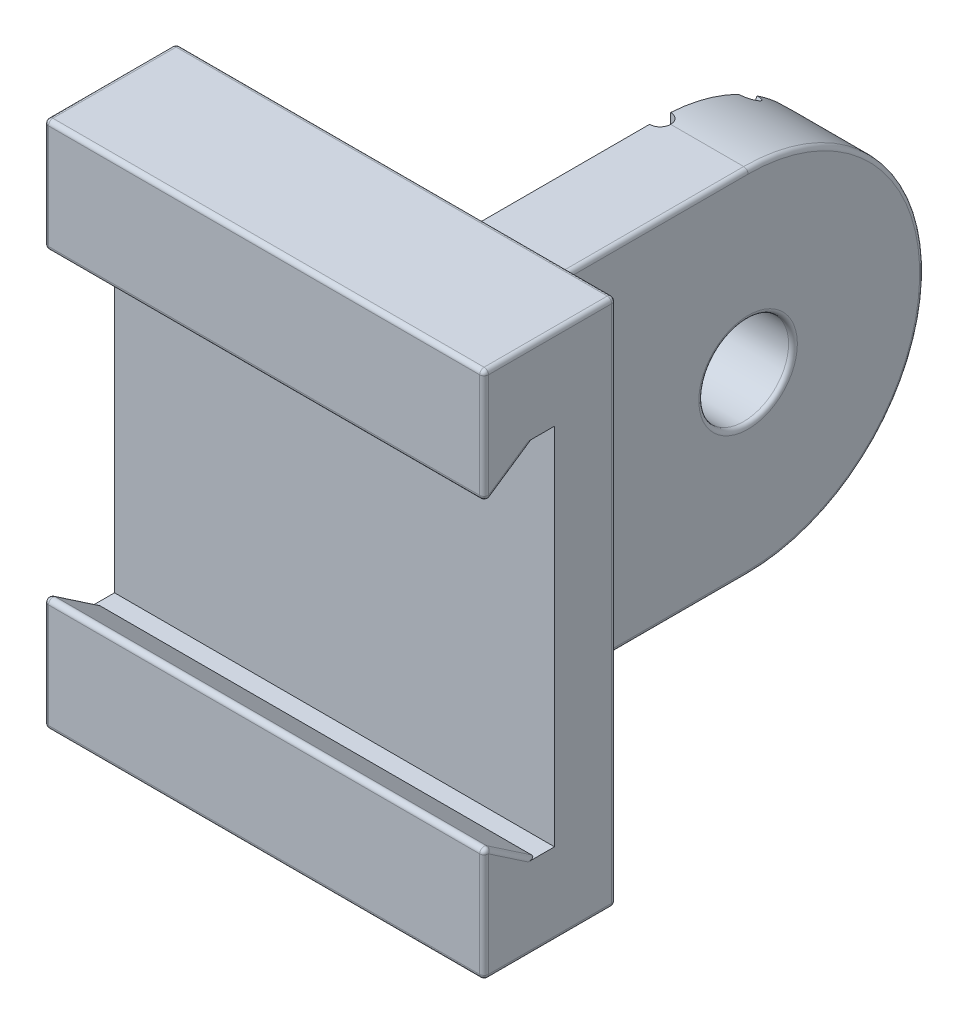
from build123d import *

# Parameters (mm, degrees)
BOSS_EXTRUDE1_DEPTH     = 10
CUT_REVOLVE_THIN2_START = -20
CUT_REVOLVE_THIN2_DEPTH = 40
SKETCH9_W               = 15
SKETCH9_H               = 60
BOSS_EXTRUDE2_DEPTH     = 25
SKETCH10_W              = 15
SKETCH10_H              = 60
BOSS_EXTRUDE3_DEPTH     = 25
CUT_EXTRUDE8_DEPTH      = 74.654599313
CUT_REVOLVE_THIN1_START = -20.0000001
CUT_REVOLVE_THIN1_DEPTH = 40.5000001
SKETCH20_R              = 5.1
CUT_EXTRUDE11_DEPTH     = 65.420493634
FILLET2_R               = 0.5
FILLET3_R               = 0.5
FILLET4_R               = 0.5
FILLET5_R               = 0.5
FILLET6_R               = 0.5
FILLET7_R               = 0.5
FILLET8_R               = 0.5
FILLET9_R               = 0.5
FILLET10_R              = 0.5
CUT_REVOLVE_THIN3_START = -20
CUT_REVOLVE_THIN3_DEPTH = 40.5
CUT_REVOLVE_THIN4_START = -20
CUT_REVOLVE_THIN4_DEPTH = 40.5
CUT_REVOLVE_THIN5_START = -20
CUT_REVOLVE_THIN5_DEPTH = 40.5
CUT_REVOLVE_THIN6_START = -20.5
CUT_REVOLVE_THIN6_DEPTH = 40.499999631
CUT_REVOLVE_THIN7_START = -20.5
CUT_REVOLVE_THIN7_DEPTH = 40.499999631
CUT_REVOLVE_THIN8_START = -20.5
CUT_REVOLVE_THIN8_DEPTH = 40.499999631
SKETCH27_R              = 9
CUT_EXTRUDE10_DEPTH     = 1.2
SKETCH7_R               = 5
CUT_EXTRUDE5_DEPTH      = 65.420493634


# Read off the part's stored shape, not the designer's step: Cut-Revolve-Thin2, Cut-Revolve-Thin1, Cut-Revolve-Thin3, Cut-Revolve-Thin4, Cut-Revolve-Thin5, Cut-Revolve-Thin6, Cut-Revolve-Thin7, Cut-Revolve-Thin8
with BuildPart() as part:
    # Sketch1 → Boss-Extrude1 (new body)
    with BuildSketch(Plane(origin=(0, 0, 0), x_dir=(0, 0, -1), z_dir=(1, 0, 0))):
        with BuildLine():
            Line((0, 20), (-30, 20))
            Line((-30, 20), (-30, -20))
            Line((-30, -20), (0, -20))
            ThreePointArc((0, -20), (20, 0), (0, 20))
        make_face()
    extrude(amount=BOSS_EXTRUDE1_DEPTH)

    # Cut-Revolve-Thin2 outline → Cut-Revolve-Thin2 (cut)
    with BuildSketch(Plane(origin=(0, 0, 0), x_dir=(1, 0, 0), z_dir=(0, 1, 0)).offset(CUT_REVOLVE_THIN2_START)):
        with BuildLine():
            Line((0, 1.2), (0, -1.2))
            ThreePointArc((0, -1.2), (1.2, 0), (0, 1.2))
        make_face()
    extrude(amount=CUT_REVOLVE_THIN2_DEPTH, mode=Mode.SUBTRACT)

    # Sketch9 → Boss-Extrude2 (add)
    with BuildSketch(Plane.ZY):
        with Locations((37.5, 0)):
            Rectangle(SKETCH9_W, SKETCH9_H)
    extrude(amount=-BOSS_EXTRUDE2_DEPTH)

    # Sketch10 → Boss-Extrude3 (add)
    with BuildSketch(Plane.ZY):
        with Locations((37.5, 0)):
            Rectangle(SKETCH10_W, SKETCH10_H)
    extrude(amount=BOSS_EXTRUDE3_DEPTH)

    # Sketch11 → Cut-Extrude8 (cut, through all)
    with BuildSketch(Plane.ZY.offset(25)):
        Polygon((39.1, 20.7), (37, 20.7), (37, -20.7), (39.1, -20.7), (45, -16.7), (45, 16.7), align=None)
    extrude(amount=-CUT_EXTRUDE8_DEPTH, mode=Mode.SUBTRACT)

    # Cut-Revolve-Thin1 outline → Cut-Revolve-Thin1 (cut)
    with BuildSketch(Plane.XY.offset(CUT_REVOLVE_THIN1_START)):
        with BuildLine():
            ThreePointArc((0, -1.2), (1.2, 0), (0, 1.2))
            Line((0, 1.2), (0, -1.2))
        make_face()
    extrude(amount=CUT_REVOLVE_THIN1_DEPTH, mode=Mode.SUBTRACT)

    # Sketch20 → Cut-Extrude11 (cut, through all)
    with BuildSketch(Plane(origin=(10, 0, 0), x_dir=(0, 0, -1), z_dir=(1, 0, 0))):
        Circle(SKETCH20_R)
    extrude(amount=-CUT_EXTRUDE11_DEPTH, mode=Mode.SUBTRACT)

    # Fillet2
    fillet2_edges = [part.edges().sort_by_distance(p)[0] for p in [
        (0, 16.7, 45),
    ]]
    fillet(fillet2_edges, radius=FILLET2_R)

    # Fillet3
    fillet3_edges = [part.edges().sort_by_distance(p)[0] for p in [
        (0, -16.7, 45),
    ]]
    fillet(fillet3_edges, radius=FILLET3_R)

    # Fillet4
    fillet4_edges = [part.edges().sort_by_distance(p)[0] for p in [
        (25, 0, 30),
    ]]
    fillet(fillet4_edges, radius=FILLET4_R)

    # Fillet5
    fillet5_edges = [part.edges().sort_by_distance(p)[0] for p in [
        (-0.25, -30, 30),
        (25, -30, 37.75),
        (24.853553391, -30, 30.146446609),
    ]]
    fillet(fillet5_edges, radius=FILLET5_R)

    # Fillet6
    fillet6_edges = [part.edges().sort_by_distance(p)[0] for p in [
        (-25, -30, 37.75),
        (-25, -29.853553391, 30.146446609),
        (-25, 0.25, 30),
    ]]
    fillet(fillet6_edges, radius=FILLET6_R)

    # Fillet7
    fillet7_edges = [part.edges().sort_by_distance(p)[0] for p in [
        (0, 30, 30),
        (24.853553391, 30, 30.146446609),
        (-24.853553391, 30, 30.146446609),
        (25, 30, 37.75),
        (-25, 30, 37.75),
    ]]
    fillet(fillet7_edges, radius=FILLET7_R)

    # Fillet8
    fillet8_edges = [part.edges().sort_by_distance(p)[0] for p in [
        (-25, 18.964603102, 41.659710424),
        (25, 18.964603102, 41.659710424),
        (-25, 23.571530227, 45),
        (-25, 17.201308501, 44.734211896),
        (25, 23.571530227, 45),
        (25, 17.201308501, 44.734211896),
        (0, 30, 45),
        (-24.853553391, 29.853553391, 45),
        (24.853553391, 29.853553391, 45),
    ]]
    fillet(fillet8_edges, radius=FILLET8_R)

    # Fillet9
    fillet9_edges = [part.edges().sort_by_distance(p)[0] for p in [
        (-25, -17.201308501, 44.734211896),
        (25, -17.201308501, 44.734211896),
        (0, -30, 45),
        (25, -23.571530227, 45),
        (24.853553391, -29.853553391, 45),
        (-25, -23.571530227, 45),
        (-24.853553391, -29.853553391, 45),
        (25, -18.964603102, 41.659710424),
        (-25, -18.964603102, 41.659710424),
    ]]
    fillet(fillet9_edges, radius=FILLET9_R)

    # Fillet10
    fillet10_edges = [part.edges().sort_by_distance(p)[0] for p in [
        (10, 0, 5.1),
        (10, 0, 30),
        (10, -20, 15),
        (10, 0, -20),
        (5, -20, 30),
        (5, 20, 30),
        (10, 20, 15),
    ]]
    fillet(fillet10_edges, radius=FILLET10_R)

    # Cut-Revolve-Thin3 outline → Cut-Revolve-Thin3 (cut)
    with BuildSketch(Plane(origin=(0, 0, 0), x_dir=(1, 0, 0), z_dir=(0, 0.4999999999999952, 0.8660254037844414)).offset(CUT_REVOLVE_THIN3_START)):
        with BuildLine():
            ThreePointArc((0, -1.2), (1.2, 0), (0, 1.2))
            Line((0, 1.2), (0, -1.2))
        make_face()
    extrude(amount=CUT_REVOLVE_THIN3_DEPTH, mode=Mode.SUBTRACT)

    # Cut-Revolve-Thin4 outline → Cut-Revolve-Thin4 (cut)
    with BuildSketch(Plane(origin=(0, 0, 0), x_dir=(1, 0, 0), z_dir=(0, 0.707106781186544, 0.707106781186551)).offset(CUT_REVOLVE_THIN4_START)):
        with BuildLine():
            ThreePointArc((0, -1.2), (1.2, 0), (0, 1.2))
            Line((0, 1.2), (0, -1.2))
        make_face()
    extrude(amount=CUT_REVOLVE_THIN4_DEPTH, mode=Mode.SUBTRACT)

    # Cut-Revolve-Thin5 outline → Cut-Revolve-Thin5 (cut)
    with BuildSketch(Plane(origin=(0, 0, 0), x_dir=(1, 0, 0), z_dir=(0, 0.866025403784438, 0.500000000000001)).offset(CUT_REVOLVE_THIN5_START)):
        with BuildLine():
            ThreePointArc((0, -1.2), (1.2, 0), (0, 1.2))
            Line((0, 1.2), (0, -1.2))
        make_face()
    extrude(amount=CUT_REVOLVE_THIN5_DEPTH, mode=Mode.SUBTRACT)

    # Cut-Revolve-Thin6 outline → Cut-Revolve-Thin6 (cut)
    with BuildSketch(Plane(origin=(0, 0, 0), x_dir=(1, 0, 0), z_dir=(0, 0.500000000000001, -0.866025403784438)).offset(CUT_REVOLVE_THIN6_START)):
        with BuildLine():
            Line((0, 1.2), (0, -1.2))
            ThreePointArc((0, -1.2), (1.2, 0), (0, 1.2))
        make_face()
    extrude(amount=CUT_REVOLVE_THIN6_DEPTH, mode=Mode.SUBTRACT)

    # Cut-Revolve-Thin7 outline → Cut-Revolve-Thin7 (cut)
    with BuildSketch(Plane(origin=(0, 0, 0), x_dir=(1, 0, 0), z_dir=(0, 0.7071067811865511, -0.7071067811865441)).offset(CUT_REVOLVE_THIN7_START)):
        with BuildLine():
            Line((0, 1.2), (0, -1.2))
            ThreePointArc((0, -1.2), (1.2, 0), (0, 1.2))
        make_face()
    extrude(amount=CUT_REVOLVE_THIN7_DEPTH, mode=Mode.SUBTRACT)

    # Cut-Revolve-Thin8 outline → Cut-Revolve-Thin8 (cut)
    with BuildSketch(Plane(origin=(0, 0, 0), x_dir=(1, 0, 0), z_dir=(0, 0.8660254037844414, -0.4999999999999952)).offset(CUT_REVOLVE_THIN8_START)):
        with BuildLine():
            Line((0, 1.2), (0, -1.2))
            ThreePointArc((0, -1.2), (1.2, 0), (0, 1.2))
        make_face()
    extrude(amount=CUT_REVOLVE_THIN8_DEPTH, mode=Mode.SUBTRACT)

    # Sketch27 → Cut-Extrude10 (cut)
    with BuildSketch(Plane.ZY):
        Circle(SKETCH27_R)
    extrude(amount=-CUT_EXTRUDE10_DEPTH, mode=Mode.SUBTRACT)

    # Sketch7 → Cut-Extrude5 (cut, through all)
    with BuildSketch(Plane(origin=(10, 0, 0), x_dir=(0, 0, -1), z_dir=(1, 0, 0))):
        Circle(SKETCH7_R)
    extrude(amount=-CUT_EXTRUDE5_DEPTH, mode=Mode.SUBTRACT)


solid = part.part
